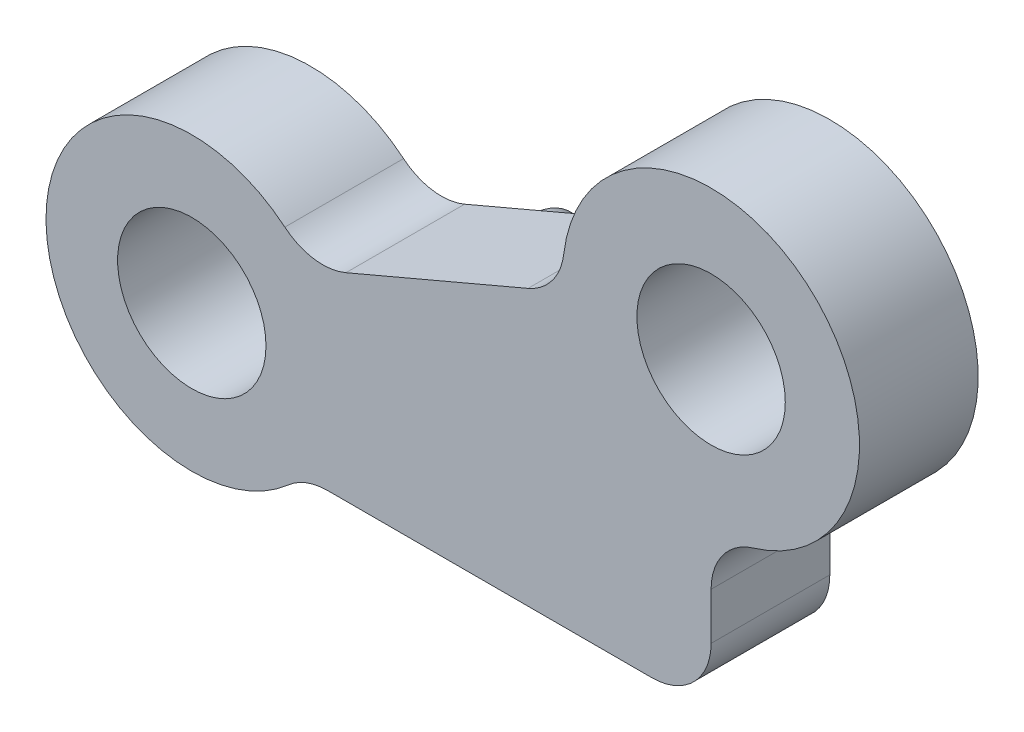
from build123d import *

# Parameters (mm, degrees)
SKETCH1_R           = 2.5
BOSS_EXTRUDE1_DEPTH = 4
FILLET1_R           = 2
SKETCH7_R           = 1.45
BOSS_EXTRUDE4_DEPTH = 2


with BuildPart() as part:
    # Sketch1 → Boss-Extrude1 (new body)
    with BuildSketch(Plane.XY):
        with BuildLine():
            Line((56.839071038, 28.579919803), (56.839071038, 23.292312115))
            Line((56.839071038, 23.292312115), (43.08257304, 23.292312115))
            ThreePointArc((43.08257304, 23.292312115), (34.429928081, 26.628647856), (43.273147001, 29.420937259))
            Line((43.273147001, 29.420937259), (51.8645252, 33.076041142))
            ThreePointArc((51.8645252, 33.076041142), (60.191727201, 37.289326312), (56.839071038, 28.579919803))
        make_face()
        with Locations((39.340592987, 26.475947236)):
            Circle(SKETCH1_R, mode=Mode.SUBTRACT)
        with Locations((56.839071038, 33.579919803)):
            Circle(SKETCH1_R, mode=Mode.SUBTRACT)
    extrude(amount=BOSS_EXTRUDE1_DEPTH)

    # Fillet1
    fillet1_edges = [part.edges().sort_by_distance(p)[0] for p in [
        (43.08257304, 23.292312115, 2),
        (56.839071038, 23.292312115, 2),
        (56.839071038, 28.579919803, 2),
        (43.273147001, 29.420937259, 2),
        (51.8645252, 33.076041142, 2),
    ]]
    fillet(fillet1_edges, radius=FILLET1_R)

    # Sketch7 → Boss-Extrude4 (add)
    with BuildSketch(Plane(origin=(45, 0, 0), x_dir=(0, 0, -1), z_dir=(1, 0, 0))):
        with BuildLine():
            Line((0, 30.085013217), (0, 23.292312115))
            add(Edge.make_bspline(
                [(1.686529373, 24.998236456), (0.321671269, 24.563285773), (0, 23.292312115)],
                knots=[0, 0, 0, 1, 1, 1], degree=2))
            ThreePointArc((1.686529373, 24.998236456), (3.688292917, 27), (1.686529373, 29.001763544))
            add(Edge.make_bspline(
                [(1.686529373, 29.001763544), (0.692192011, 29.34207863), (0, 30.085013217)],
                knots=[0, 0, 0, 1, 1, 1], degree=2))
        make_face()
        with Locations((1.686529373, 27)):
            Circle(SKETCH7_R, mode=Mode.SUBTRACT)
    extrude(amount=BOSS_EXTRUDE4_DEPTH)


solid = part.part
